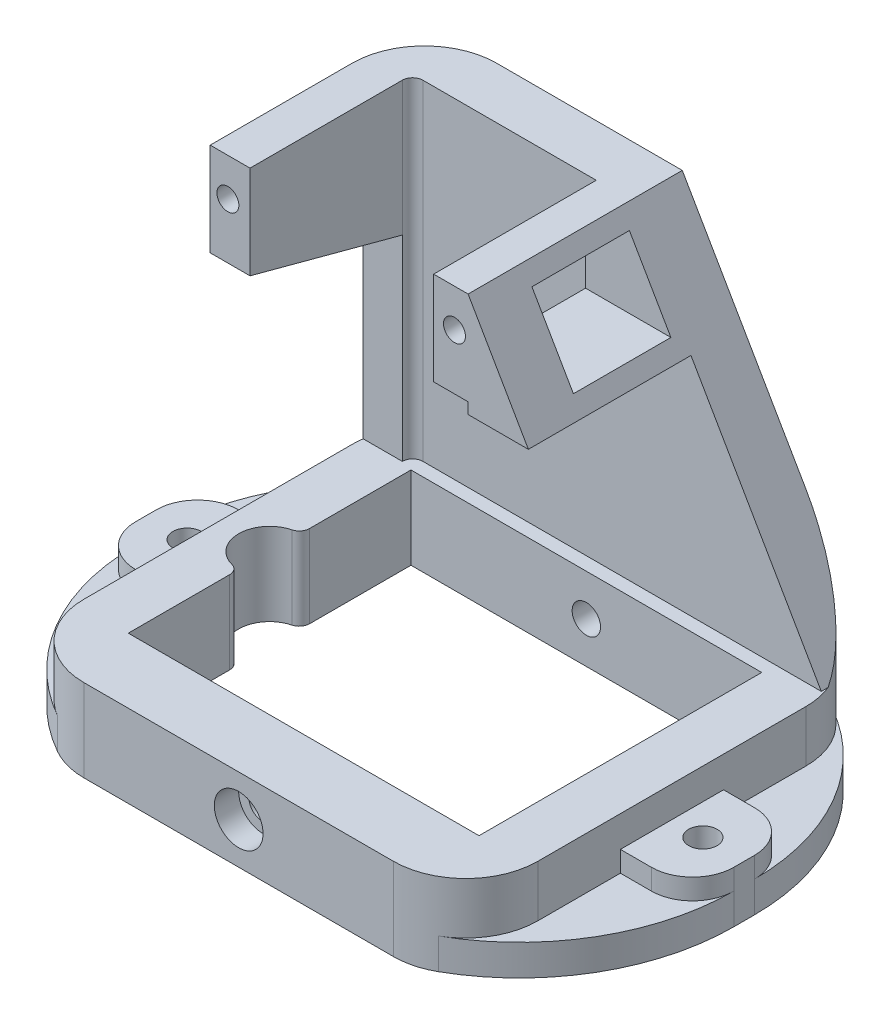
from build123d import *

# Parameters (mm, degrees)
SKETCH1_W           = 55.88
SKETCH1_H           = 50.8
SKETCH1_W_2         = 43.18
SKETCH1_H_2         = 34.798
BOSS_EXTRUDE1_DEPTH = 10.16
SKETCH2_R           = 1.75
CUT_EXTRUDE1_DEPTH  = 59.860081549
SKETCH3_R           = 3
CUT_EXTRUDE2_DEPTH  = 3
SKETCH4_W           = 4.9022
SKETCH4_H           = 20.0152
BOSS_EXTRUDE2_DEPTH = 40.64
CUT_EXTRUDE3_DEPTH  = 77.318648395
FILLET1_R           = 8.89
CHAMFER2_SIZE2      = 40.64
CHAMFER2_SIZE       = 23.46351494
SKETCH6_W           = 4.2418
SKETCH6_H           = 11.487238798
BOSS_EXTRUDE3_DEPTH = 20.0152
BOSS_EXTRUDE5_DEPTH = 20.0152
SKETCH9_R           = 1.35
CUT_EXTRUDE4_DEPTH  = 8
FILLET2_R           = 1.27
BOSS_EXTRUDE6_DEPTH = 6.35
SKETCH11_R          = 1.75
CUT_EXTRUDE5_DEPTH  = 25.4
BOSS_EXTRUDE7_DEPTH = 3.81
CUT_EXTRUDE6_REACH  = 76.62
SKETCH13_W          = 12
SKETCH13_H          = 8.848420696
CUT_EXTRUDE9_REACH  = 62.442
FILLET3_R           = 1.27


# Some blends are built 0.0001 mm under size
with BuildPart() as part:
    # Sketch1 → Boss-Extrude1 (new body)
    with BuildSketch(Plane(origin=(0, 0, 0), x_dir=(1, 0, 0), z_dir=(0, 1, 0))):
        Rectangle(SKETCH1_W, SKETCH1_H)
        Rectangle(SKETCH1_W_2, SKETCH1_H_2, mode=Mode.SUBTRACT)
    extrude(amount=BOSS_EXTRUDE1_DEPTH)

    # Sketch2 → Cut-Extrude1 (cut, through all)
    with BuildSketch(Plane.XY.offset(25.4)):
        with Locations((0, 5.08)):
            Circle(SKETCH2_R)
    extrude(amount=-CUT_EXTRUDE1_DEPTH, mode=Mode.SUBTRACT)

    # Sketch3 → Cut-Extrude2 (cut)
    with BuildSketch(Plane.XY.offset(25.4)):
        with Locations((0, 5.08)):
            Circle(SKETCH3_R)
    cut_extrude2 = extrude(amount=-CUT_EXTRUDE2_DEPTH, mode=Mode.SUBTRACT)

    # Sketch4 → Boss-Extrude2 (add)
    with BuildSketch(Plane(origin=(0, 10.16, 0), x_dir=(1, 0, 0), z_dir=(0, 1, 0))):
        with Locations((-25.4889, 9.0424)):
            Rectangle(SKETCH4_W, SKETCH4_H)
        Polygon((3.81, 25.4), (-27.94, 25.4), (-27.94, 19.05), (-23.0378, 19.05), (3.81, 19.05), align=None)
    extrude(amount=BOSS_EXTRUDE2_DEPTH)

    # Sketch5 → Cut-Extrude3 (cut, through all)
    with BuildSketch(Plane(origin=(-23.0378, 0, 0), x_dir=(0, 0, -1), z_dir=(1, 0, 0))):
        Polygon((17.78, 34.29), (-0.9652, 39.312761202), (-0.9652, 10.16), (17.78, 10.16), align=None)
    extrude(amount=-CUT_EXTRUDE3_DEPTH, mode=Mode.SUBTRACT)

    # Fillet1
    # the kernel refuses this fillet: 8.89 mm, written as the material it takes off along each edge
    with BuildSketch(Plane(origin=(-27.94, -22.225, 25.4), x_dir=(1, 0, 0), z_dir=(0, 1, 0)), Plane(origin=(27.94, -22.225, -25.4), x_dir=(-1, 0, 0), z_dir=(0, 1, 0))) as fillet1_piece_1:
        with BuildLine():
            CenterArc((FILLET1_R, FILLET1_R), FILLET1_R, 180, 90)
            Line((0, FILLET1_R), (0, 0))
            Line((0, 0), (FILLET1_R, 0))
        make_face()
    extrude(amount=54.61, mode=Mode.SUBTRACT)
    with BuildSketch(Plane(origin=(-27.94, -22.225, -25.4), x_dir=(1, 0, 0), z_dir=(0, 1, 0))) as fillet1_piece_2:
        with BuildLine():
            CenterArc((FILLET1_R, -FILLET1_R), FILLET1_R, 90, 90)
            Line((0, -FILLET1_R), (0, 0))
            Line((0, 0), (FILLET1_R, 0))
        make_face()
    extrude(amount=95.25, mode=Mode.SUBTRACT)
    with BuildSketch(Plane(origin=(27.94, -22.225, 25.4), x_dir=(-1, 0, 0), z_dir=(0, 1, 0))) as fillet1_piece_3:
        with BuildLine():
            CenterArc((FILLET1_R, -FILLET1_R), FILLET1_R, 90, 90)
            Line((0, -FILLET1_R), (0, 0))
            Line((0, 0), (FILLET1_R, 0))
        make_face()
    extrude(amount=54.61, mode=Mode.SUBTRACT)

    # Chamfer2
    chamfer2_edges = [part.edges().sort_by_distance(p)[0] for p in [
        (3.81, 10.16, -22.225),
    ]]
    chamfer2_side = [part.faces().sort_by_distance(p)[0] for p in [
        (4.279270299, 10.16, -22.225),
    ]]
    chamfer(chamfer2_edges, length=CHAMFER2_SIZE - 0.0001, length2=CHAMFER2_SIZE2 - 0.0001, reference=chamfer2_side[0])  # a hair under: the kernel refuses the full size

    # Sketch6 → Boss-Extrude3 (add)
    with BuildSketch(Plane.XY.offset(-19.05)):
        with Locations((1.6891, 45.056380601)):
            Rectangle(SKETCH6_W, SKETCH6_H)
    extrude(amount=BOSS_EXTRUDE3_DEPTH)

    # Sketch8 → Boss-Extrude5 (add)
    with BuildSketch(Plane.XY.offset(-19.05)):
        Polygon((3.81, 50.8), (3.81, 37.951579304), (11.228039147, 37.951579304), align=None)
    extrude(amount=BOSS_EXTRUDE5_DEPTH)

    # Sketch9 → Cut-Extrude4 (cut)
    with BuildSketch(Plane.XY.offset(0.9652)):
        with Locations((2.13195, 46.132)):
            Circle(SKETCH9_R)
        with Locations((-25.76195, 46.132)):
            Circle(SKETCH9_R)
    extrude(amount=-CUT_EXTRUDE4_DEPTH, mode=Mode.SUBTRACT)

    # Fillet2
    fillet2_edges = [part.edges().sort_by_distance(p)[0] for p in [
        (-23.0378, 30.48, -19.05),
    ]]
    fillet(fillet2_edges, radius=FILLET2_R)

    # Mirror1: Cut-Extrude2 across plane
    add(cut_extrude2.mirror(Plane.XY), mode=Mode.SUBTRACT)

    # Sketch10 → Boss-Extrude6 (add)
    with BuildSketch(Plane.XZ):
        with BuildLine():
            Line((-27.94, 0), (-27.94, 6.35))
            Line((-27.94, 6.35), (-31.75, 6.35))
            ThreePointArc((-31.75, 6.35), (-35.342102448, 4.862102448), (-36.83, 1.27))
            Line((-36.83, 1.27), (-36.83, -1.27))
            ThreePointArc((-36.83, -1.27), (-35.342102448, -4.862102448), (-31.75, -6.35))
            Line((-31.75, -6.35), (-27.94, -6.35))
            Line((-27.94, -6.35), (-27.94, 0))
        make_face()
    boss_extrude6 = extrude(amount=-BOSS_EXTRUDE6_DEPTH)

    # Mirror2: Boss-Extrude6 across plane
    add(boss_extrude6.mirror(Plane(origin=(0, 0, 0), x_dir=(0, 0, 1), z_dir=(1, 0, 0))))

    # Sketch11 → Cut-Extrude5 (cut)
    with BuildSketch(Plane.XZ):
        with Locations(Location((-31.75, 0, 0), (0, 0, 270))):
            Circle(SKETCH11_R)
        with Locations(Location((31.75, 0, 0), (0, 0, 270))):
            Circle(SKETCH11_R)
    extrude(amount=-CUT_EXTRUDE5_DEPTH, mode=Mode.SUBTRACT)

    # Sketch12 → Boss-Extrude7 (add)
    with BuildSketch(Plane.XZ):
        with BuildLine():
            ThreePointArc((-27.94, 16.51), (-26.728994429, 20.989413417), (-23.425906736, 24.248445596))
            ThreePointArc((-23.425906736, 24.248445596), (-33.234054886, 14.57111535), (-36.83, 1.27))
            ThreePointArc((-36.83, 1.27), (-35.342102448, 4.862102448), (-31.75, 6.35))
            Line((-31.75, 6.35), (-27.94, 6.35))
            Line((-27.94, 6.35), (-27.94, 16.51))
        make_face()
        with BuildLine():
            ThreePointArc((-31.75, -6.35), (-35.342102448, -4.862102448), (-36.83, -1.27))
            ThreePointArc((-36.83, -1.27), (-33.234054886, -14.57111535), (-23.425906736, -24.248445596))
            ThreePointArc((-23.425906736, -24.248445596), (-26.728994429, -20.989413417), (-27.94, -16.51))
            Line((-27.94, -16.51), (-27.94, -6.35))
            Line((-27.94, -6.35), (-31.75, -6.35))
        make_face()
        with BuildLine():
            ThreePointArc((23.425906736, -24.248445596), (33.234054886, -14.57111535), (36.83, -1.27))
            ThreePointArc((36.83, -1.27), (35.342102448, -4.862102448), (31.75, -6.35))
            Line((31.75, -6.35), (27.94, -6.35))
            Line((27.94, -6.35), (27.94, -16.51))
            ThreePointArc((27.94, -16.51), (26.728994429, -20.989413417), (23.425906736, -24.248445596))
        make_face()
        with BuildLine():
            ThreePointArc((36.83, 1.27), (33.234054886, 14.57111535), (23.425906736, 24.248445596))
            ThreePointArc((23.425906736, 24.248445596), (26.728994429, 20.989413417), (27.94, 16.51))
            Line((27.94, 16.51), (27.94, 6.35))
            Line((27.94, 6.35), (31.75, 6.35))
            ThreePointArc((31.75, 6.35), (35.342102448, 4.862102448), (36.83, 1.27))
        make_face()
    extrude(amount=-BOSS_EXTRUDE7_DEPTH)

    # Sketch13 → Cut-Extrude6 (cut, up to next)
    with BuildSketch(Plane.ZY.offset(-11.5682), mode=Mode.PRIVATE) as cut_extrude6_sk1:
        with Locations((-11.7348, 44.375789652)):
            Rectangle(SKETCH13_W, SKETCH13_H)
    cut_extrude6_tool1 = extrude(cut_extrude6_sk1.sketch, amount=CUT_EXTRUDE6_REACH, mode=Mode.PRIVATE) & part.part
    add(cut_extrude6_tool1.solids().sort_by_distance((11.5682, 44.37579, -11.7348))[0], mode=Mode.SUBTRACT)

    # Sketch15 → Cut-Extrude9 (cut, up to next)
    with BuildSketch(Plane(origin=(0, 10.16, 0), x_dir=(1, 0, 0), z_dir=(0, 1, 0)), mode=Mode.PRIVATE) as cut_extrude9_sk1:
        with BuildLine():
            Line((-21.59, 3.81), (-21.59, -3.81))
            ThreePointArc((-21.59, -3.81), (-25.4, 0), (-21.59, 3.81))
        make_face()
    cut_extrude9_tool1 = extrude(cut_extrude9_sk1.sketch, amount=-CUT_EXTRUDE9_REACH, mode=Mode.PRIVATE) & part.part
    add(cut_extrude9_tool1.solids().sort_by_distance((-23.207014, 10.16, 0))[0], mode=Mode.SUBTRACT)

    # Fillet3
    fillet3_edges = [part.edges().sort_by_distance(p)[0] for p in [
        (-21.59, 5.08, 3.81),
        (-21.59, 5.08, -3.81),
    ]]
    fillet(fillet3_edges, radius=FILLET3_R)


solid = part.part
